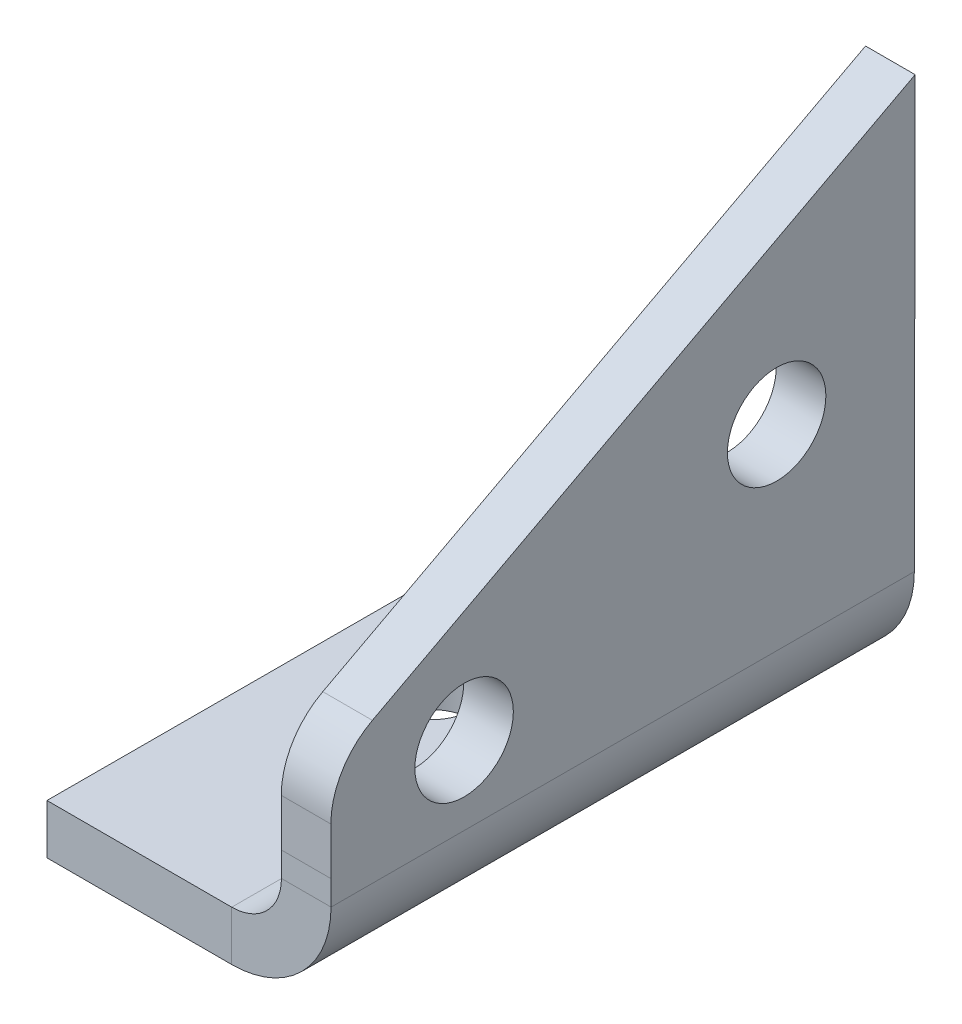
from build123d import *

# Parameters (mm, degrees)
BASE_FLANGE1_DEPTH            = 3.175
EDGE_FLANGE1_STRIP_W          = 19.05
EDGE_FLANGE1_STRIP_H          = 3.175
EDGE_FLANGE1_STRIP_CUT_DEPTH  = 37.325997284
EDGE_FLANGE1_RELIEF_W         = 20.6375
EDGE_FLANGE1_RELIEF_H         = 1.5875
EDGE_FLANGE1_RELIEF_CUT_DEPTH = 3.175
EDGE_FLANGE1_DEPTH            = 37.325997284
SKETCH15_R                    = 2.65
CUT_EXTRUDE2_DEPTH            = 10
SKETCH19_R                    = 3.15
CUT_EXTRUDE4_DEPTH            = 10


# Sheet-metal steps are written as plain solids
with BuildPart() as part:
    # Sketch3 → Base-Flange1 (new body)
    with BuildSketch(Plane(origin=(0, 0, 0), x_dir=(0, 0, -1), z_dir=(1, 0, 0))):
        with BuildLine():
            Line((83.106142408, 32.105064535), (45.780209905, 32.174606262))
            Line((45.780209905, 32.174606262), (45.780209905, 43.136168925))
            ThreePointArc((45.780209905, 43.136168925), (46.495831721, 45.713784796), (48.437851335, 47.553561406))
            Line((48.437851335, 47.553561406), (83.169236275, 65.970162941))
            Line((83.169236275, 65.970162941), (83.106142408, 32.105064535))
        make_face()
    extrude(amount=-BASE_FLANGE1_DEPTH)

    # Edge-Flange1 strip (across the edge) → Edge-Flange1 strip cut (cut)
    with BuildSketch(Plane(origin=(-3.175, 32.105064535, -83.106142408), x_dir=(-3.4914813388431334e-15, 0.999998264444559, -0.001863090945206598), z_dir=(0, 0.001863090945206598, 0.999998264444559))):
        with Locations((-3.175, -1.5875)):
            Rectangle(EDGE_FLANGE1_STRIP_W, EDGE_FLANGE1_STRIP_H)
    extrude(amount=EDGE_FLANGE1_STRIP_CUT_DEPTH, mode=Mode.SUBTRACT)

    # Edge-Flange1 relief (on the sheet) → Edge-Flange1 relief cut (cut)
    with BuildSketch(Plane(origin=(-3.175, 38.455053514, -83.117973035), x_dir=(-6.982962677686267e-15, 0.999998264444559, -0.001863090945206598), z_dir=(-1, 0, 0))):
        with Locations((-8.73125, -38.119747284)):
            Rectangle(EDGE_FLANGE1_RELIEF_W, EDGE_FLANGE1_RELIEF_H)
    extrude(amount=-EDGE_FLANGE1_RELIEF_CUT_DEPTH, mode=Mode.SUBTRACT)

    # Edge-Flange1 section (across the edge) → Edge-Flange1 (add)
    with BuildSketch(Plane(origin=(-3.175, 32.105064535, -83.106142408), x_dir=(-3.4914813388431334e-15, 0.999998264444559, -0.001863090945206598), z_dir=(0, 0.001863090945206598, 0.999998264444559))):
        with BuildLine():
            Line((0, 3.175), (0, 15))
            Line((0, 15), (3.175, 15))
            Line((3.175, 15), (3.175, 3.175))
            ThreePointArc((3.175, 3.175), (4.10493597, 0.92993597), (6.35, 0))
            Line((6.35, 0), (6.35, -3.175))
            ThreePointArc((6.35, -3.175), (1.859871939, -1.315128061), (0, 3.175))
        make_face()
    extrude(amount=EDGE_FLANGE1_DEPTH)

    # Sketch15 → Cut-Extrude2 (cut)
    with BuildSketch(Plane(origin=(0, 35.434781617, -0.066018335), x_dir=(1, 0, 0), z_dir=(-3.23986857388729e-15, 0.999998264444559, -0.0018630909452065992))):
        with Locations(Location((-12.2625, 64.389781839, 0), (0, 0, 270))):
            Circle(SKETCH15_R)
    extrude(amount=-CUT_EXTRUDE2_DEPTH, mode=Mode.SUBTRACT)

    # Sketch19 → Cut-Extrude4 (cut)
    with BuildSketch(Plane.ZY.offset(3.175)):
        with Locations((-74.30640548, 51.024595242)):
            Circle(SKETCH19_R)
        with Locations((-54.306440614, 43.524595242)):
            Circle(SKETCH19_R)
    extrude(amount=-CUT_EXTRUDE4_DEPTH, mode=Mode.SUBTRACT)


solid = part.part
